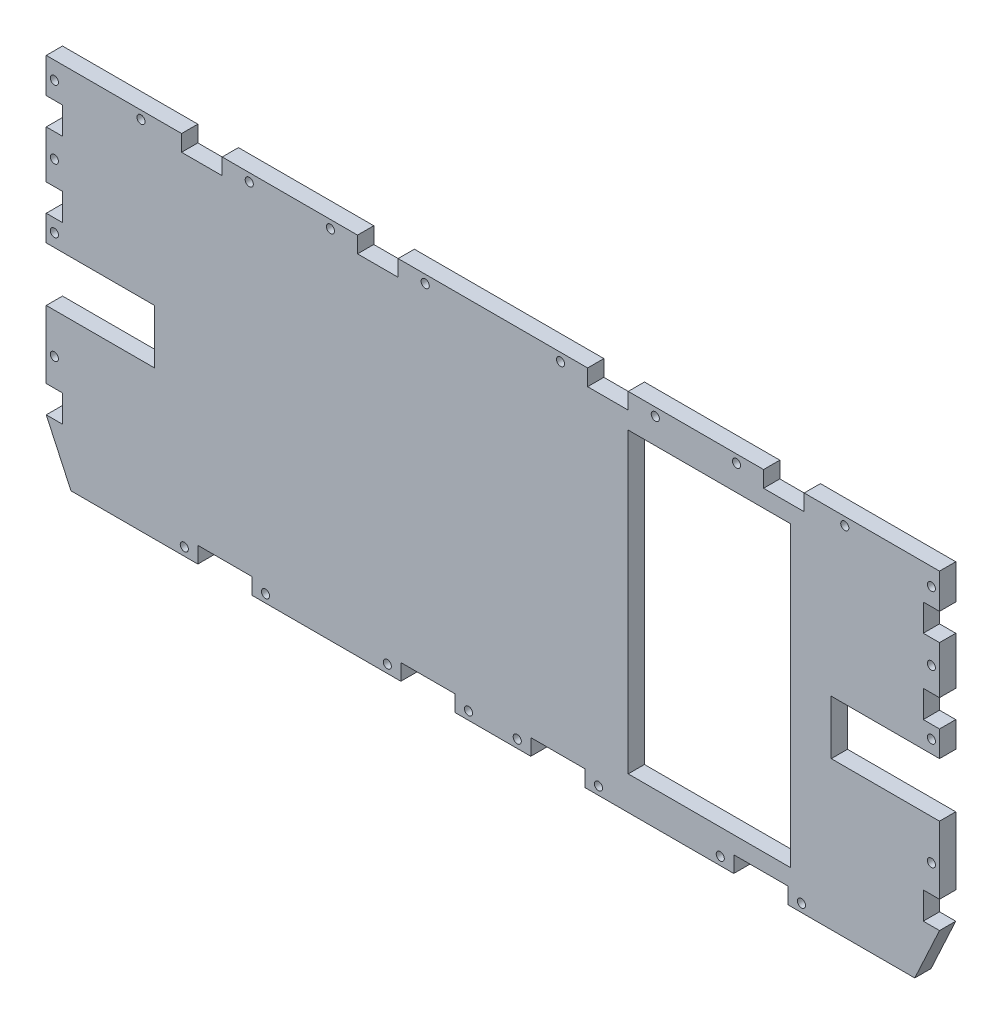
from build123d import *

# Parameters (mm, degrees)
BOSS_EXTRU_1_DEPTH      = 6
ESQUISSE3_W             = 6
ESQUISSE3_H             = 10
ESQUISSE3_W_2           = 20
ESQUISSE3_H_2           = 6
ESQUISSE3_W_3           = 60
ESQUISSE3_H_3           = 110
ESQUISSE3_W_4           = 15
ESQUISSE3_W_5           = 40
ESQUISSE3_H_4           = 20
ENL_V_MAT_EXTRU_2_DEPTH = 6
ESQUISSE4_R             = 1.5
ENL_V_MAT_EXTRU_3_DEPTH = 6
ESQUISSE5_W             = 456.045253014
ESQUISSE5_H             = 136.228984631
ENL_V_MAT_EXTRU_4_DEPTH = 6


with BuildPart() as part:
    # Esquisse1 → Boss.-Extru.1 (new body)
    with BuildSketch(Plane.XY):
        Polygon((-165, 96.73), (165, 96.73), (165, -18.27), (123, -109.022410436), (-123, -109.022410436), (-165, -18.27), align=None)
    extrude(amount=BOSS_EXTRU_1_DEPTH)

    # Esquisse3 → Enlèv. mat.-Extru.2 (cut)
    with BuildSketch(Plane(origin=(0, 0, 0), x_dir=(-1, 0, 0), z_dir=(0, 0, -1))):
        with Locations((162, -13.27)):
            Rectangle(ESQUISSE3_W, ESQUISSE3_H)
        with Locations((162, 78.852589564)):
            Rectangle(ESQUISSE3_W, ESQUISSE3_H)
        with Locations((-24, -35.02)):
            Rectangle(ESQUISSE3_W_2, ESQUISSE3_H_2)
        with Locations((99, -35.02)):
            Rectangle(ESQUISSE3_W_2, ESQUISSE3_H_2)
        with Locations((-162, 51.23)):
            Rectangle(ESQUISSE3_W, ESQUISSE3_H)
        with Locations((-80, 29.355)):
            Rectangle(ESQUISSE3_W_3, ESQUISSE3_H_3)
        with Locations((24, -35.02)):
            Rectangle(ESQUISSE3_W_2, ESQUISSE3_H_2)
        with Locations((-162, 78.852589564)):
            Rectangle(ESQUISSE3_W, ESQUISSE3_H)
        with Locations((-162, -13.27)):
            Rectangle(ESQUISSE3_W, ESQUISSE3_H)
        with Locations((107.5, 93.73)):
            Rectangle(ESQUISSE3_W_4, ESQUISSE3_H_2)
        with Locations((-42.5, 93.73)):
            Rectangle(ESQUISSE3_W_4, ESQUISSE3_H_2)
        with Locations((42.5, 93.73)):
            Rectangle(ESQUISSE3_W_4, ESQUISSE3_H_2)
        with Locations((-107.5, 93.73)):
            Rectangle(ESQUISSE3_W_4, ESQUISSE3_H_2)
        with Locations((162, 51.23)):
            Rectangle(ESQUISSE3_W, ESQUISSE3_H)
        with Locations((-99, -35.02)):
            Rectangle(ESQUISSE3_W_2, ESQUISSE3_H_2)
        with Locations((-145, 26.73)):
            Rectangle(ESQUISSE3_W_5, ESQUISSE3_H_4)
        with Locations((145, 26.73)):
            Rectangle(ESQUISSE3_W_5, ESQUISSE3_H_4)
    extrude(amount=-ENL_V_MAT_EXTRU_2_DEPTH, mode=Mode.SUBTRACT)

    # Esquisse4 → Enlèv. mat.-Extru.3 (cut)
    with BuildSketch(Plane(origin=(0, 0, 0), x_dir=(-1, 0, 0), z_dir=(0, 0, -1))):
        with Locations((162, 1.92)):
            Circle(ESQUISSE4_R)
        with Locations((114, -35.02)):
            Circle(ESQUISSE4_R)
        with Locations((162, 65.042589564)):
            Circle(ESQUISSE4_R)
        with Locations((84, -35.02)):
            Circle(ESQUISSE4_R)
        with Locations((39, -35.02)):
            Circle(ESQUISSE4_R)
        with Locations((162, 90.29)):
            Circle(ESQUISSE4_R)
        with Locations((9, -35.02)):
            Circle(ESQUISSE4_R)
        with Locations((-9, -35.02)):
            Circle(ESQUISSE4_R)
        with Locations((-39, -35.02)):
            Circle(ESQUISSE4_R)
        with Locations((-84, -35.02)):
            Circle(ESQUISSE4_R)
        with Locations((130, 93.73)):
            Circle(ESQUISSE4_R)
        with Locations((-114, -35.02)):
            Circle(ESQUISSE4_R)
        with Locations((90, 93.73)):
            Circle(ESQUISSE4_R)
        with Locations((-162, 41.48)):
            Circle(ESQUISSE4_R)
        with Locations((60, 93.73)):
            Circle(ESQUISSE4_R)
        with Locations((25, 93.73)):
            Circle(ESQUISSE4_R)
        with Locations((-25, 93.73)):
            Circle(ESQUISSE4_R)
        with Locations((-60, 93.73)):
            Circle(ESQUISSE4_R)
        with Locations((-90, 93.73)):
            Circle(ESQUISSE4_R)
        with Locations((-130, 93.73)):
            Circle(ESQUISSE4_R)
        with Locations((-162, 90.29)):
            Circle(ESQUISSE4_R)
        with Locations((-162, 65.042589564)):
            Circle(ESQUISSE4_R)
        with Locations((-162, 1.92)):
            Circle(ESQUISSE4_R)
        with Locations((162, 41.48)):
            Circle(ESQUISSE4_R)
    extrude(amount=-ENL_V_MAT_EXTRU_3_DEPTH, mode=Mode.SUBTRACT)

    # Esquisse5 → Enlèv. mat.-Extru.4 (cut)
    with BuildSketch(Plane(origin=(0, 0, 0), x_dir=(-1, 0, 0), z_dir=(0, 0, -1))):
        with Locations((-18.307092018, -106.134492316)):
            Rectangle(ESQUISSE5_W, ESQUISSE5_H)
    extrude(amount=-ENL_V_MAT_EXTRU_4_DEPTH, mode=Mode.SUBTRACT)


solid = part.part
